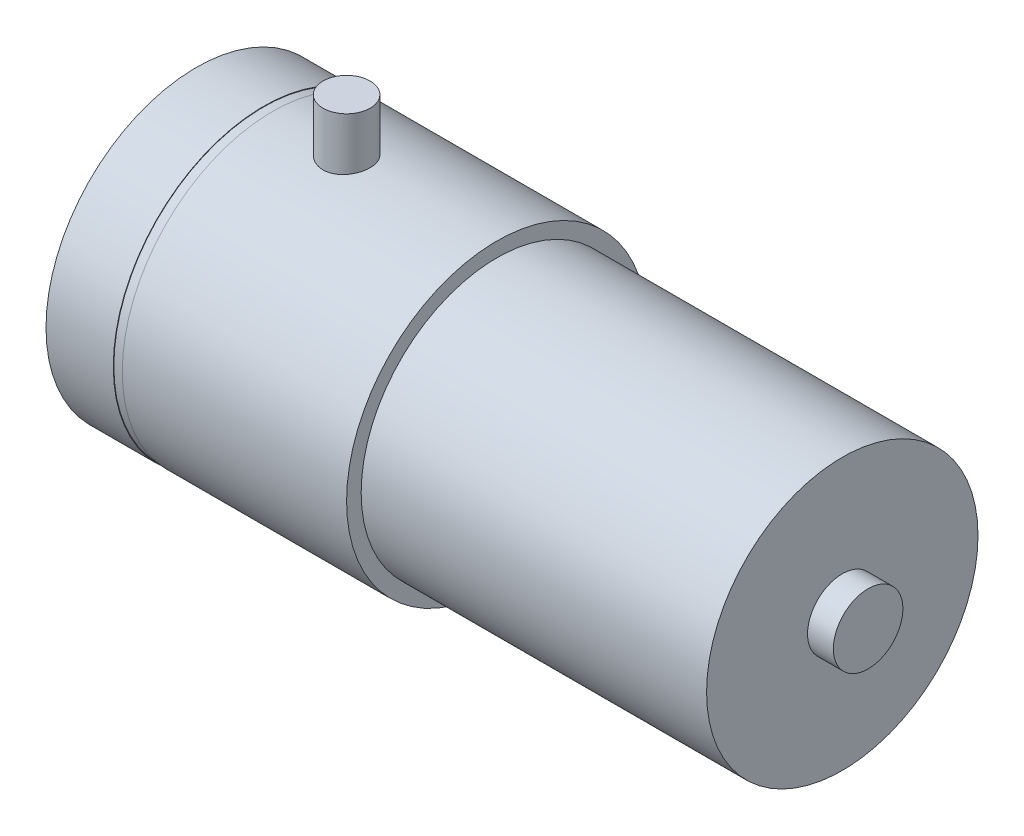
from build123d import *

# Parameters (mm, degrees)
ESQUISSE2_R             = 2.1
BOSS_EXTRU_1_DEPTH      = 18
ENL_V_START             = -6.8
ESQUISSE3_R             = 13.4
ESQUISSE3_R_2           = 13.35
ENL_V_MAT_EXTRU_1_DEPTH = 0.8


with BuildPart() as part:
    # Esquisse1 → Révolution1 (revolve)
    with BuildSketch(Plane.XY):
        Polygon((-33.6, 0), (-33.6, 2.15), (-26.8, 2.15), (-26.8, 13.4), (0, 13.4), (0, 12.1), (30.8, 12.1), (30.8, 3.1), (33.1, 3.1), (33.1, 0), align=None)
    revolve(axis=Axis((0, 0, 0), (1, 0, 0)))

    # Esquisse2 → Boss.-Extru.1 (add)
    with BuildSketch(Plane(origin=(0, 0, 0), x_dir=(1, 0, 0), z_dir=(0, 1, 0))):
        with Locations((-13.399848902, 0)):
            Circle(ESQUISSE2_R)
    extrude(amount=BOSS_EXTRU_1_DEPTH)

    # Esquisse3 → Enlèv. mat.-Extru.1 (cut)
    with BuildSketch(Plane.ZY.offset(26.8).offset(ENL_V_START)):
        Circle(ESQUISSE3_R)
        Circle(ESQUISSE3_R_2, mode=Mode.SUBTRACT)
    extrude(amount=ENL_V_MAT_EXTRU_1_DEPTH, mode=Mode.SUBTRACT)


solid = part.part
